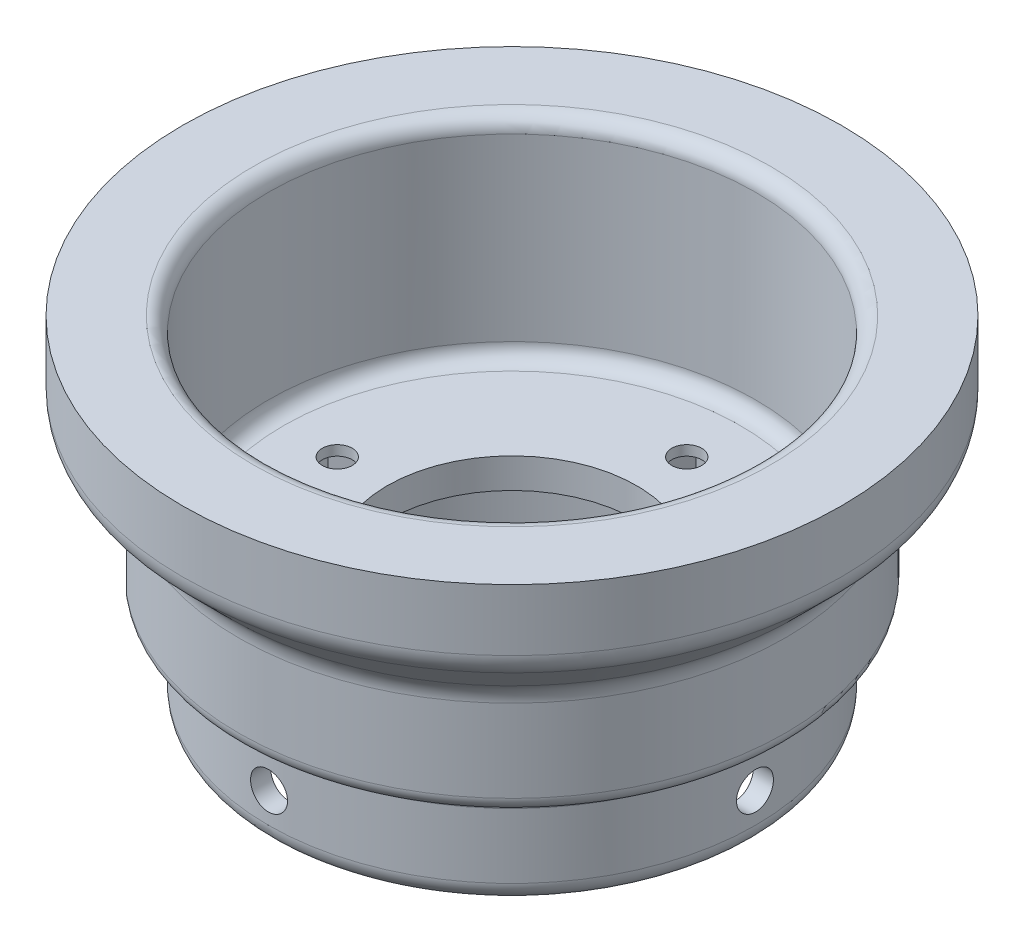
from build123d import *

# Parameters (mm, degrees)
SKETCH1_R                = 24.4
SKETCH1_R_2              = 12.5
BOSS_EXTRUDE1_DEPTH      = 3
SKETCH2_R                = 1.5
CUT_EXTRUDE1_DEPTH       = 35.636974464
CUT_EXTRUDE2_DEPTH       = 2
CIRPATTERN1_COUNT        = 4
BOSS_EXTRUDE2_START      = 10
SKETCH4_R                = 24.4
SKETCH4_R_2              = 22.4
BOSS_EXTRUDE2_DEPTH      = 10
SKETCH5_R                = 1.85
CUT_EXTRUDE4_DEPTH       = 36.926591823
CIRPATTERN2_COUNT        = 4
FILLET1_R                = 2
BOSS_EXTRUDE3_DEPTH      = 21
BOSS_EXTRUDE3_DEPTH_BACK = 3
SKETCH7_R                = 27.4
SKETCH7_R_2              = 24.4
SKETCH8_R                = 33
SKETCH8_R_2              = 27.4
BOSS_EXTRUDE4_DEPTH      = 3
FILLET2_R                = 1.5
CHAMFER1_SIZE            = 10
FILLET4_R                = 3
CUT_EXTRUDE5_START       = -0.126920057
CUT_EXTRUDE5_DEPTH       = 16.126920057


with BuildPart() as part:
    # Sketch1 → Boss-Extrude1 (new body)
    with BuildSketch(Plane(origin=(0, 0, 0), x_dir=(1, 0, 0), z_dir=(0, 1, 0))):
        with Locations(Location((0, 0, 0), (0, 0, 270))):
            Circle(SKETCH1_R)
        with Locations(Location((0, 0, 0), (0, 0, 270))):
            Circle(SKETCH1_R_2, mode=Mode.SUBTRACT)
    extrude(amount=BOSS_EXTRUDE1_DEPTH)

    # Sketch2 → Cut-Extrude1 (cut, symmetric)
    with BuildSketch(Plane(origin=(0, 3, 0), x_dir=(1, 0, 0), z_dir=(0, 1, 0))):
        with Locations(Location((0, 17.5, 0), (0, 0, 270))):
            Circle(SKETCH2_R)
    cut_extrude1 = extrude(amount=CUT_EXTRUDE1_DEPTH, both=True, mode=Mode.SUBTRACT)

    # Sketch3 → Cut-Extrude2 (cut)
    with BuildSketch(Plane.XZ):
        Polygon((2.482606158, -17.5), (1.241303079, -15.35), (-1.241303079, -15.35), (-2.482606158, -17.5), (-1.241303079, -19.65), (1.241303079, -19.65), align=None)
    cut_extrude2 = extrude(amount=-CUT_EXTRUDE2_DEPTH, mode=Mode.SUBTRACT)

    # CirPattern1: Cut-Extrude1, Cut-Extrude2 ×4 about axis
    cirpattern1_axis = Axis((0, 0, 0), (0, 1, 0))
    add([cut_extrude1.rotate(cirpattern1_axis, i * 360 / CIRPATTERN1_COUNT) for i in range(1, CIRPATTERN1_COUNT)], mode=Mode.SUBTRACT)
    add([cut_extrude2.rotate(cirpattern1_axis, i * 360 / CIRPATTERN1_COUNT) for i in range(1, CIRPATTERN1_COUNT)], mode=Mode.SUBTRACT)

    # Sketch4 → Boss-Extrude2 (add)
    with BuildSketch(Plane.XZ.offset(BOSS_EXTRUDE2_START)):
        with Locations(Location((0, 0, 0), (0, 0, 270))):
            Circle(SKETCH4_R)
        with Locations(Location((0, 0, 0), (0, 0, 270))):
            Circle(SKETCH4_R_2, mode=Mode.SUBTRACT)
    extrude(amount=-BOSS_EXTRUDE2_DEPTH)

    # Sketch5 → Cut-Extrude4 (cut, through all)
    with BuildSketch(Plane(origin=(0, 0, 0), x_dir=(0, 0, -1), z_dir=(1, 0, 0))):
        with Locations((0, -5)):
            Circle(SKETCH5_R)
    cut_extrude4 = extrude(amount=-CUT_EXTRUDE4_DEPTH, mode=Mode.SUBTRACT)

    # CirPattern2: Cut-Extrude4 ×4 about axis
    cirpattern2_axis = Axis((0, 3, 0), (0, -1, 0))
    for i in range(1, CIRPATTERN2_COUNT):
        add(cut_extrude4.rotate(cirpattern2_axis, i * 360 / CIRPATTERN2_COUNT), mode=Mode.SUBTRACT)

    # Fillet1
    fillet1_edges = [part.edges().sort_by_distance(p)[0] for p in [
        (0, -10, 24.4),
    ]]
    fillet(fillet1_edges, radius=FILLET1_R - 0.0001)  # a hair under: the kernel refuses the full size

    # Sketch7 → Boss-Extrude3 (add, two sides: drawn at the far end of the back side and taken through both)
    with BuildSketch(Plane(origin=(0, 3, 0), x_dir=(1, 0, 0), z_dir=(0, 1, 0)).offset(-BOSS_EXTRUDE3_DEPTH_BACK)):
        with Locations(Location((0, 0, 0), (0, 0, 270))):
            Circle(SKETCH7_R)
        with Locations(Location((0, 0, 0), (0, 0, 90))):
            Circle(SKETCH7_R_2, mode=Mode.SUBTRACT)
    extrude(amount=BOSS_EXTRUDE3_DEPTH + BOSS_EXTRUDE3_DEPTH_BACK)

    # Sketch8 → Boss-Extrude4 (add)
    with BuildSketch(Plane(origin=(0, 24, 0), x_dir=(1, 0, 0), z_dir=(0, 1, 0))):
        with Locations(Location((0, 0, 0), (0, 0, 270))):
            Circle(SKETCH8_R)
        with Locations(Location((0, 0, 0), (0, 0, 270))):
            Circle(SKETCH8_R_2, mode=Mode.SUBTRACT)
    extrude(amount=-BOSS_EXTRUDE4_DEPTH)

    # Fillet2
    fillet2_edges = [part.edges().sort_by_distance(p)[0] for p in [
        (0, 0, 24.4),
        (0, 3, 24.4),
        (0, 0, -27.4),
        (0, 24, 24.4),
    ]]
    fillet(fillet2_edges, radius=FILLET2_R - 0.0001)  # a hair under: the kernel refuses the full size

    # Chamfer1
    # the kernel refuses this chamfer: 10 mm, written as the material it adds along each edge
    with BuildSketch(Plane(origin=(0, 21, 0), x_dir=(0, 0, 1), z_dir=(-1, 0, 0))) as chamfer1_piece_1_section:
        Polygon((27.4, -CHAMFER1_SIZE), (27.4 + CHAMFER1_SIZE, 0), (27.4, 0), align=None)
    chamfer1_piece_1 = revolve(axis=Axis((0, 21, 0), (0, 1, 0)), mode=Mode.PRIVATE)
    chamfer1_piece_1 = chamfer1_piece_1 & Plane(origin=(0, 21, 0), x_dir=(0, 0, 1), z_dir=(0, 1, 0)) * Cylinder(33, 150, mode=Mode.PRIVATE)
    add(chamfer1_piece_1)

    # Fillet4
    fillet4_edges = [part.edges().sort_by_distance(p)[0] for p in [
        (0, 11, -27.4),
        (0, 16.6, -33),
    ]]
    fillet(fillet4_edges, radius=FILLET4_R)

    # Cut-Extrude5: read off the stored shape, not the designer's step
    # Cut-Extrude5 outline → Cut-Extrude5 (cut)
    with BuildSketch(Plane(origin=(-8.75, 0, 8.75), x_dir=(0.7071067811865488, 0, 0.7071067811865462), z_dir=(-0.7071067811865462, 0, 0.7071067811865488)).offset(CUT_EXTRUDE5_START)):
        with BuildLine():
            ThreePointArc((2.5, 7), (0, 9.5), (-2.5, 7))
            Line((-2.5, 7), (-2.5, -1))
            ThreePointArc((-2.5, -1), (8e-09, -3.5), (2.5, -0.999999985))
            Line((2.5, -0.999999985), (2.5, 7))
        make_face()
    extrude(amount=CUT_EXTRUDE5_DEPTH, mode=Mode.SUBTRACT)


solid = part.part
